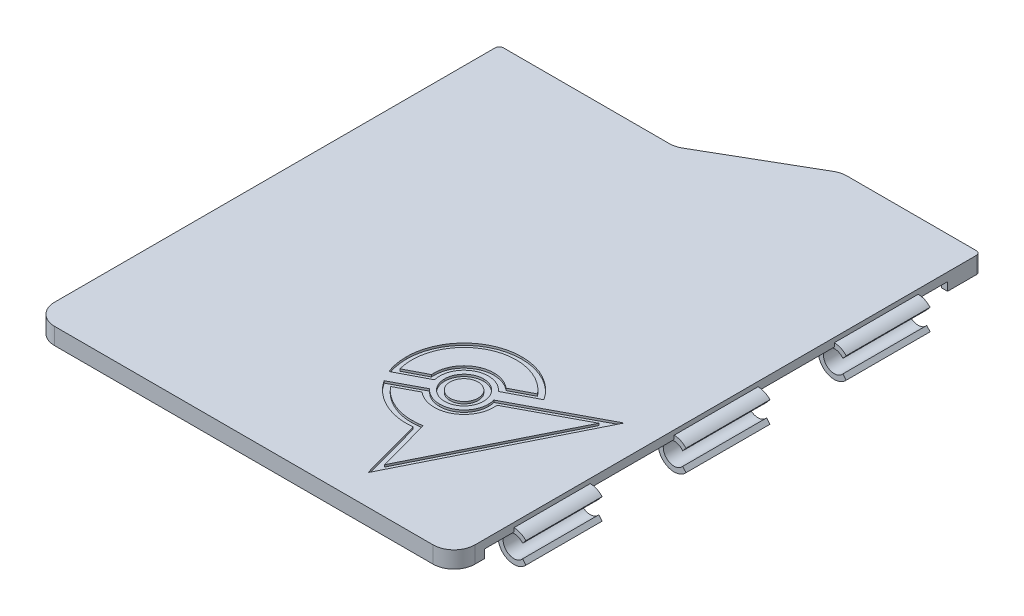
from build123d import *
from OCP.BRepAlgoAPI import BRepAlgoAPI_Cut
from OCP.TopTools import TopTools_ListOfShape

# Parameters (mm, degrees)
BOSS_EXTRUDE1_DEPTH = 5.066666693
SKETCH2_R           = 4.826
SKETCH2_R_2         = 3.302
BOSS_EXTRUDE2_DEPTH = 122.379478956
CUT_EXTRUDE1_START  = -122.379478956
SKETCH3_R           = 3.302
CUT_EXTRUDE1_DEPTH  = 122.379478956
CUT_EXTRUDE2_DEPTH  = 3.161666693
SKETCH6_W           = 8.89
SKETCH6_H           = 2.54
CUT_EXTRUDE3_DEPTH  = 6.35
CUT_EXTRUDE4_DEPTH  = 23.089739478
CUT_EXTRUDE5_DEPTH  = 25.4
CUT_EXTRUDE6_DEPTH  = 3.161666693
SKETCH11_W          = 8.255
SKETCH11_H          = 3.161666693
CUT_EXTRUDE7_DEPTH  = 12.7
SKETCH12_W          = 8.89
SKETCH12_H          = 3.161666693
CUT_EXTRUDE8_DEPTH  = 3.175
CUT_EXTRUDE9_START  = -61.189739
CUT_EXTRUDE9_DEPTH  = 122.379478
FILLET1_R           = 6.35
FILLET2_R           = 6.35
FILLET3_R           = 1.27
CUT_EXTRUDE11_DEPTH = 0.635


with BuildPart() as part:
    # Sketch1 → Boss-Extrude1 (new body)
    with BuildSketch(Plane(origin=(0, 0, 0), x_dir=(1, 0, 0), z_dir=(0, 1, 0))):
        Polygon((63.633333278, -79.34000007), (-63.633333278, -79.34000007), (-63.633333278, 61.624739478), (-10.433096124, 61.624739478), (21.464700955, 80.040941207), (63.633333278, 80.040941207), align=None)
    extrude(amount=BOSS_EXTRUDE1_DEPTH)

    # Sketch2 → Boss-Extrude2 (add)
    with BuildSketch(Plane.XY.offset(-61.189739478)):
        with Locations((63.633333278, -1.159759877)):
            Circle(SKETCH2_R)
        with Locations((63.633333278, -1.159759877)):
            Circle(SKETCH2_R_2, mode=Mode.SUBTRACT)
    extrude(amount=BOSS_EXTRUDE2_DEPTH)

    # Sketch3 → Cut-Extrude1 (cut)
    with BuildSketch(Plane.XY.offset(61.189739478).offset(CUT_EXTRUDE1_START)):
        with Locations(Location((63.633333278, -1.159759877, 0), (0, 0, 159.437463466))):
            Circle(SKETCH3_R)
    extrude(amount=CUT_EXTRUDE1_DEPTH, mode=Mode.SUBTRACT)

    # Sketch4 → Cut-Extrude2 (cut)
    with BuildSketch(Plane.XZ):
        Polygon((60.541705709, 63.094739478), (61.728333278, 63.094739478), (61.728333278, 77.43500007), (-61.728333278, 77.43500007), (-61.728333278, -59.719739478), (-9.922652912, -59.719739478), (21.975144166, -78.135941207), (61.728333278, -78.135941207), (61.728333278, -63.094739478), (60.541705709, -63.094739478), (57.043759335, -63.094739478), (57.043759335, 63.094739478), align=None)
    extrude(amount=-CUT_EXTRUDE2_DEPTH, mode=Mode.SUBTRACT)

    # Sketch6 → Cut-Extrude3 (cut)
    with BuildSketch(Plane(origin=(63.633333278, 0, 0), x_dir=(0, 0, -1), z_dir=(1, 0, 0))):
        with Locations((-65.634739478, 1.27)):
            Rectangle(SKETCH6_W, SKETCH6_H)
        with Locations((65.634739478, 1.27)):
            Rectangle(SKETCH6_W, SKETCH6_H)
    extrude(amount=-CUT_EXTRUDE3_DEPTH, mode=Mode.SUBTRACT)

    # Sketch9 → Cut-Extrude4 (cut)
    with BuildSketch(Plane.XY.offset(-12.7)):
        Polygon((72.499612576, -6.351792342), (72.499612576, 4.336950569), (63.633333278, 4.336950569), (63.633333278, 2.54), (61.728333278, 2.54), (61.728333278, 3.161666693), (56.300109038, 3.161666693), (56.300109038, -6.351792342), align=None)
    extrude(amount=-CUT_EXTRUDE4_DEPTH, mode=Mode.SUBTRACT)

    # Sketch8 → Cut-Extrude5 (cut)
    with BuildSketch(Plane.XY.offset(12.7)):
        Polygon((56.300109038, -6.351792342), (72.499612576, -6.351792342), (72.499612576, 4.336950569), (63.633333278, 4.336950569), (63.633333278, 2.54), (61.728333278, 2.54), (61.728333278, 3.161666693), (56.300109038, 3.161666693), align=None)
    extrude(amount=CUT_EXTRUDE5_DEPTH, mode=Mode.SUBTRACT)

    # Sketch10 → Cut-Extrude6 (cut)
    with BuildSketch(Plane.XZ):
        Polygon((61.728333278, 63.094739478), (61.728333278, 61.189739478), (58.948759335, 61.189739478), (58.948759335, -61.189739478), (61.728333278, -61.189739478), (61.728333278, -63.094739478), (57.043759335, -63.094739478), (57.043759335, 63.094739478), align=None)
    extrude(amount=-CUT_EXTRUDE6_DEPTH, mode=Mode.SUBTRACT)

    # Sketch11 → Cut-Extrude7 (cut, symmetric)
    with BuildSketch(Plane(origin=(0, 0, -33.93961522), x_dir=(0, 0, 1), z_dir=(-1, 0, 0))):
        with Locations((-32.012624257, 1.580833347)):
            Rectangle(SKETCH11_W, SKETCH11_H)
    extrude(amount=CUT_EXTRUDE7_DEPTH, both=True, mode=Mode.SUBTRACT)

    # Sketch12 → Cut-Extrude8 (cut, symmetric)
    with BuildSketch(Plane(origin=(0, 0, -61.624739478), x_dir=(-1, 0, 0), z_dir=(0, 0, -1))):
        with Locations((42.109999981, 1.580833347)):
            Rectangle(SKETCH12_W, SKETCH12_H)
    extrude(amount=CUT_EXTRUDE8_DEPTH, both=True, mode=Mode.SUBTRACT)


with BuildPart() as cut_extrude9_tool:
    # Sketch13 → Cut-Extrude9 (new body)
    with BuildSketch(Plane.XY.offset(CUT_EXTRUDE9_START)):
        Polygon((66.236058773, -3.191759877), (66.236058773, 0.872240123), (69.80317921, 5.123368719), (69.80317921, -7.442888473), align=None)
    extrude(amount=CUT_EXTRUDE9_DEPTH)


with BuildPart() as part_1:
    add(part.part)

    # Cut-Extrude9: cut by cut_extrude9_tool, with a tolerance
    cut_extrude9_stock = TopTools_ListOfShape()
    cut_extrude9_stock.Append(part_1.part.wrapped)
    cut_extrude9_tools = TopTools_ListOfShape()
    cut_extrude9_tools.Append(cut_extrude9_tool.part.wrapped)
    cut_extrude9_cut = BRepAlgoAPI_Cut()
    cut_extrude9_cut.SetArguments(cut_extrude9_stock)
    cut_extrude9_cut.SetTools(cut_extrude9_tools)
    cut_extrude9_cut.SetFuzzyValue(0.00001)
    cut_extrude9_cut.Build()
    add(Compound.cast(cut_extrude9_cut.Shape()).solids(), mode=Mode.REPLACE)

    # Fillet1
    fillet1_edges = [part_1.edges().sort_by_distance(p)[0] for p in [
        (63.633333278, 2.533333347, 79.34000007),
        (-63.633333278, 2.533333347, 79.34000007),
    ]]
    fillet(fillet1_edges, radius=FILLET1_R)

    # Fillet2
    fillet2_edges = [part_1.edges().sort_by_distance(p)[0] for p in [
        (21.464700955, 2.533333347, -80.040941207),
        (-10.433096124, 2.533333347, -61.624739478),
    ]]
    fillet(fillet2_edges, radius=FILLET2_R)

    # Fillet3
    fillet3_edges = [part_1.edges().sort_by_distance(p)[0] for p in [
        (-63.633333278, 2.533333347, -61.624739478),
        (63.633333278, 2.533333347, -80.040941207),
    ]]
    fillet(fillet3_edges, radius=FILLET3_R)

    # Sketch15 → Cut-Extrude11 (cut)
    # profile 1 of 3: a face of its own
    with BuildSketch(Plane(origin=(0, 5.066666693, 0), x_dir=(1, 0, 0), z_dir=(0, 1, 0))):
        with BuildLine():
            Line((5.176469003, -40.551683227), (14.239706536, -35.839200478))
            add(Edge.make_bspline(
                [(14.239706536, -35.839200478), (14.100214974, -35.272424235), (14.02567552, -34.680081737), (14.02567552, -34.070234415)],
                knots=[3, 3, 3, 3, 4, 4, 4, 4], degree=3))
            add(Edge.make_bspline(
                [(14.02567552, -34.070234415), (14.02567552, -29.995871581), (17.328616905, -26.692930196), (21.40300853, -26.692930196)],
                knots=[4, 4, 4, 4, 5, 5, 5, 5], degree=3))
            add(Edge.make_bspline(
                [(21.40300853, -26.692930196), (23.621888864, -26.692930196), (25.611795741, -27.672710868), (26.964216102, -29.223039381)],
                knots=[5, 5, 5, 5, 6, 6, 6, 6], degree=3))
            Line((26.964216102, -29.223039381), (36.025927722, -24.511333985))
            add(Edge.make_bspline(
                [(36.025927722, -24.511333985), (32.905865677, -19.748093006), (27.522355096, -16.600967582), (21.40300853, -16.600967582)],
                knots=[7, 7, 7, 7, 8, 8, 8, 8], degree=3))
            add(Edge.make_bspline(
                [(21.40300853, -16.600967582), (11.755000487, -16.600967582), (3.933741697, -24.422226372), (3.933741697, -34.070234415)],
                knots=[0, 0, 0, 0, 1, 1, 1, 1], degree=3))
            add(Edge.make_bspline(
                [(3.933741697, -34.070234415), (3.933741697, -36.360516003), (4.375191465, -38.547467308), (5.176469003, -40.551683227)],
                knots=[1, 1, 1, 1, 2, 2, 2, 2], degree=3))
        make_face()
        with BuildLine():
            Line((33.548880032, -23.938482877), (27.266087935, -27.205262982))
            add(Edge.make_bspline(
                [(27.266087935, -27.205262982), (25.641766993, -25.818063301), (23.56646652, -25.041948947), (21.40300853, -25.041948947)],
                knots=[3, 3, 3, 3, 4, 4, 4, 4], degree=3))
            add(Edge.make_bspline(
                [(21.40300853, -25.041948947), (20.184926174, -25.041948947), (19.00240049, -25.28088403), (17.888281813, -25.752103514)],
                knots=[4, 4, 4, 4, 5, 5, 5, 5], degree=3))
            add(Edge.make_bspline(
                [(17.888281813, -25.752103514), (16.813001964, -26.206912226), (15.847645497, -26.857671314), (15.019016672, -27.686271348)],
                knots=[5, 5, 5, 5, 6, 6, 6, 6], degree=3))
            add(Edge.make_bspline(
                [(15.019016672, -27.686271348), (14.190416639, -28.514900173), (13.53965755, -29.480227849), (13.084848838, -30.555507698)],
                knots=[6, 6, 6, 6, 7, 7, 7, 7], degree=3))
            add(Edge.make_bspline(
                [(13.084848838, -30.555507698), (12.613629354, -31.669626375), (12.374694272, -32.852152059), (12.374694272, -34.070234415)],
                knots=[7, 7, 7, 7, 8, 8, 8, 8], degree=3))
            add(Edge.make_bspline(
                [(12.374694272, -34.070234415), (12.374694272, -34.356472829), (12.388254752, -34.642509706), (12.415231758, -34.92702067)],
                knots=[8, 8, 8, 8, 9, 9, 9, 9], degree=3))
            Line((12.415231758, -34.92702067), (6.1279195, -38.196132832))
            add(Edge.make_bspline(
                [(6.1279195, -38.196132832), (5.766940097, -36.858482166), (5.584722946, -35.477127023), (5.584722946, -34.070234415)],
                knots=[10, 10, 10, 10, 11, 11, 11, 11], degree=3))
            add(Edge.make_bspline(
                [(5.584722946, -34.070234415), (5.584722946, -31.93404134), (6.00273698, -29.862656419), (6.827133552, -27.913546145)],
                knots=[11, 11, 11, 11, 12, 12, 12, 12], degree=3))
            add(Edge.make_bspline(
                [(6.827133552, -27.913546145), (7.623746976, -26.030107751), (8.764525959, -24.338272317), (10.217800591, -22.885026476)],
                knots=[12, 12, 12, 12, 13, 13, 13, 13], degree=3))
            add(Edge.make_bspline(
                [(10.217800591, -22.885026476), (11.671046432, -21.431751844), (13.362881866, -20.290972861), (15.246320261, -19.494359437)],
                knots=[13, 13, 13, 13, 14, 14, 14, 14], degree=3))
            add(Edge.make_bspline(
                [(15.246320261, -19.494359437), (17.195430534, -18.669962864), (19.266815455, -18.251948831), (21.40300853, -18.251948831)],
                knots=[14, 14, 14, 14, 15, 15, 15, 15], degree=3))
            add(Edge.make_bspline(
                [(21.40300853, -18.251948831), (24.076064178, -18.251948831), (26.717104424, -18.930721395), (29.040581836, -20.214907493)],
                knots=[0, 0, 0, 0, 1, 1, 1, 1], degree=3))
            add(Edge.make_bspline(
                [(29.040581836, -20.214907493), (30.757263755, -21.163709234), (32.29095117, -22.433615082), (33.548880032, -23.938482877)],
                knots=[1, 1, 1, 1, 2, 2, 2, 2], degree=3))
        make_face(mode=Mode.SUBTRACT)
    # profile 2 of 3: a face of its own
    with BuildSketch(Plane(origin=(0, 5.066666693, 0), x_dir=(1, 0, 0), z_dir=(0, 1, 0))):
        with BuildLine():
            Line((54.257143822, -18.477323433), (28.532596465, -32.16940636))
            add(Edge.make_bspline(
                [(28.532596465, -32.16940636), (28.693882684, -32.775913946), (28.78031275, -33.412939809), (28.78031275, -34.070234415)],
                knots=[1, 1, 1, 1, 2, 2, 2, 2], degree=3))
            add(Edge.make_bspline(
                [(28.78031275, -34.070234415), (28.78031275, -38.144626041), (25.477371365, -41.447538635), (21.40300853, -41.447538635)],
                knots=[2, 2, 2, 2, 3, 3, 3, 3], degree=3))
            add(Edge.make_bspline(
                [(21.40300853, -41.447538635), (19.186287509, -41.447538635), (17.198165663, -40.469686948), (15.845860466, -38.922007191)],
                knots=[3, 3, 3, 3, 4, 4, 4, 4], degree=3))
            Line((15.845860466, -38.922007191), (6.837699786, -43.716658964))
            add(Edge.make_bspline(
                [(6.837699786, -43.716658964), (6.838045276, -43.717205989), (6.838419557, -43.717753015), (6.838765047, -43.718300041)],
                knots=[5, 5, 5, 5, 6, 6, 6, 6], degree=3))
            add(Edge.make_bspline(
                [(6.838765047, -43.718300041), (9.967406759, -48.431646515), (15.321867394, -51.539501249), (21.40300853, -51.539501249)],
                knots=[6, 6, 6, 6, 7, 7, 7, 7], degree=3))
            add(Edge.make_bspline(
                [(21.40300853, -51.539501249), (22.05693461, -51.539501249), (22.702108278, -51.50236108), (23.3373779, -51.432370577)],
                knots=[7, 7, 7, 7, 8, 8, 8, 8], degree=3))
            Line((23.3373779, -51.432370577), (28.485264343, -70.258146069))
            Line((28.485264343, -70.258146069), (54.257143822, -18.477323433))
        make_face()
        with BuildLine():
            Line((50.482061646, -22.356916315), (28.936013549, -65.647237361))
            Line((28.936013549, -65.647237361), (24.55799385, -49.636916953))
            Line((24.55799385, -49.636916953), (23.1565715, -49.791322164))
            add(Edge.make_bspline(
                [(23.1565715, -49.791322164), (22.571196382, -49.855813619), (21.981214732, -49.88852), (21.40300853, -49.88852)],
                knots=[3, 3, 3, 3, 4, 4, 4, 4], degree=3))
            add(Edge.make_bspline(
                [(21.40300853, -49.88852), (16.702761883, -49.88852), (12.3030339, -47.817336615), (9.312041138, -44.269932308)],
                knots=[4, 4, 4, 4, 5, 5, 5, 5], degree=3))
            Line((9.312041138, -44.269932308), (15.554353331, -40.94744195))
            add(Edge.make_bspline(
                [(15.554353331, -40.94744195), (17.176572542, -42.32695448), (19.246201222, -43.098519884), (21.40300853, -43.098519884)],
                knots=[6, 6, 6, 6, 7, 7, 7, 7], degree=3))
            add(Edge.make_bspline(
                [(21.40300853, -43.098519884), (22.621090887, -43.098519884), (23.803616571, -42.859584801), (24.917706457, -42.388365317)],
                knots=[7, 7, 7, 7, 8, 8, 8, 8], degree=3))
            add(Edge.make_bspline(
                [(24.917706457, -42.388365317), (25.993015097, -41.933556605), (26.958342773, -41.282826307), (27.786971598, -40.454197483)],
                knots=[8, 8, 8, 8, 9, 9, 9, 9], degree=3))
            add(Edge.make_bspline(
                [(27.786971598, -40.454197483), (28.615571631, -39.625597449), (29.26633072, -38.660240982), (29.721139432, -37.584961132)],
                knots=[9, 9, 9, 9, 10, 10, 10, 10], degree=3))
            add(Edge.make_bspline(
                [(29.721139432, -37.584961132), (30.192358916, -36.470842456), (30.431293999, -35.288316772), (30.431293999, -34.070234415)],
                knots=[10, 10, 10, 10, 11, 11, 11, 11], degree=3))
            add(Edge.make_bspline(
                [(30.431293999, -34.070234415), (30.431293999, -33.731884603), (30.412407215, -33.394254562), (30.374863975, -33.059129322)],
                knots=[11, 11, 11, 11, 12, 12, 12, 12], degree=3))
            Line((30.374863975, -33.059129322), (50.482061646, -22.356916315))
        make_face(mode=Mode.SUBTRACT)
    # profile 3 of 3: a face of its own
    with BuildSketch(Plane(origin=(0, 5.066666693, 0), x_dir=(1, 0, 0), z_dir=(0, 1, 0))):
        with BuildLine():
            add(Edge.make_bspline(
                [(21.40300853, -28.173872813), (18.146535542, -28.173872813), (15.506646929, -30.813761427), (15.506646929, -34.070234415)],
                knots=[0, 0, 0, 0, 1, 1, 1, 1], degree=3))
            add(Edge.make_bspline(
                [(15.506646929, -34.070234415), (15.506646929, -37.326707404), (18.146535542, -39.966596017), (21.40300853, -39.966596017)],
                knots=[1, 1, 1, 1, 2, 2, 2, 2], degree=3))
            add(Edge.make_bspline(
                [(21.40300853, -39.966596017), (24.659452728, -39.966596017), (27.299370132, -37.326707404), (27.299370132, -34.070234415)],
                knots=[2, 2, 2, 2, 3, 3, 3, 3], degree=3))
            add(Edge.make_bspline(
                [(27.299370132, -34.070234415), (27.299370132, -30.813761427), (24.659452728, -28.173872813), (21.40300853, -28.173872813)],
                knots=[3, 3, 3, 3, 4, 4, 4, 4], degree=3))
        make_face()
        with BuildLine():
            add(Edge.make_bspline(
                [(21.40300853, -38.315614769), (19.062112667, -38.315614769), (17.157628177, -36.411130279), (17.157628177, -34.070234415), (17.157628177, -31.729338552), (19.062112667, -29.824854062), (21.40300853, -29.824854062)],
                knots=[2, 2, 2, 2, 3, 3, 3, 4, 4, 4, 4], degree=3))
            add(Edge.make_bspline(
                [(21.40300853, -29.824854062), (23.743904394, -29.824854062), (25.648388884, -31.729338552), (25.648388884, -34.070234415), (25.648388884, -36.411130279), (23.743904394, -38.315614769), (21.40300853, -38.315614769)],
                knots=[0, 0, 0, 0, 1, 1, 1, 2, 2, 2, 2], degree=3))
        make_face(mode=Mode.SUBTRACT)
    extrude(amount=-CUT_EXTRUDE11_DEPTH, mode=Mode.SUBTRACT)


solid = part_1.part
